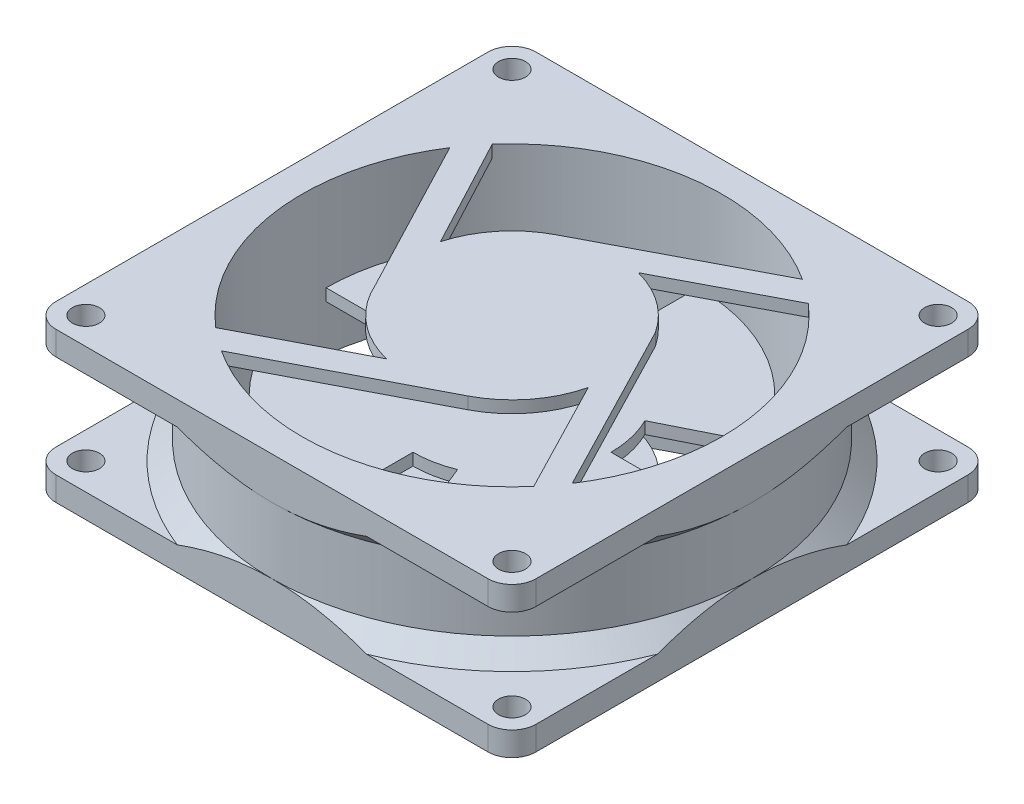
from build123d import *

# Parameters (mm, degrees)
SKETCH_1_W           = 80
SKETCH_1_H           = 80
EXTRUDE_1_DEPTH      = 4
SKETCH_3_R           = 40
EXTRUDE_2_DEPTH      = 17
SKETCH_4_W           = 80
SKETCH_4_H           = 80
EXTRUDE_3_DEPTH      = 4
SKETCH_5_R           = 35
CUT_EXTRUDE_2_DEPTH  = 38
SKETCH_6_R           = 2.25
CUT_EXTRUDE_3_DEPTH  = 38
FILLET_1_R           = 4
CHAMFER_3_SIZE       = 3
EXTRUDE_4_DEPTH      = 1
EXTRUDE_4_DEPTH_BACK = 1
EXTRUDE_5_DEPTH      = 2
EXTRUDE_START        = -2
EXTRUDE_6_DEPTH      = 2


with BuildPart() as part:
    # Эскиз1 → Бобышка-Вытянуть1 (new body)
    with BuildSketch(Plane(origin=(0, 0, 0), x_dir=(1, 0, 0), z_dir=(0, 1, 0))):
        with Locations((-12.139359553, 4.23945659)):
            Rectangle(SKETCH_1_W, SKETCH_1_H)
    extrude(amount=EXTRUDE_1_DEPTH)

    # Эскиз3 → Бобышка-Вытянуть2 (add)
    with BuildSketch(Plane(origin=(0, 4, 0), x_dir=(1, 0, 0), z_dir=(0, 1, 0))):
        with Locations(Location((-12.139359553, 4.23945659, 0), (0, 0, 270))):
            Circle(SKETCH_3_R)
    extrude(amount=EXTRUDE_2_DEPTH)

    # Эскиз4 → Бобышка-Вытянуть3 (add)
    with BuildSketch(Plane(origin=(0, 21, 0), x_dir=(1, 0, 0), z_dir=(0, 1, 0))):
        with Locations((-12.139359553, 4.23945659)):
            Rectangle(SKETCH_4_W, SKETCH_4_H)
    extrude(amount=EXTRUDE_3_DEPTH)

    # Эскиз5 → Вырез-Вытянуть2 (cut)
    with BuildSketch(Plane(origin=(0, 25, 0), x_dir=(1, 0, 0), z_dir=(0, 1, 0))):
        with Locations(Location((-12.139359553, 4.23945659, 0), (0, 0, 270))):
            Circle(SKETCH_5_R)
    extrude(amount=-CUT_EXTRUDE_2_DEPTH, mode=Mode.SUBTRACT)

    # Эскиз6 → Вырез-Вытянуть3 (cut)
    with BuildSketch(Plane(origin=(0, 25, 0), x_dir=(1, 0, 0), z_dir=(0, 1, 0))):
        with Locations(Location((-47.639359553, 39.73945659, 0), (0, 0, 270))):
            Circle(SKETCH_6_R)
        with Locations(Location((23.360640447, 39.73945659, 0), (0, 0, 270))):
            Circle(SKETCH_6_R)
        with Locations(Location((-47.639359553, -31.26054341, 0), (0, 0, 270))):
            Circle(SKETCH_6_R)
        with Locations(Location((23.360640447, -31.26054341, 0), (0, 0, 270))):
            Circle(SKETCH_6_R)
    extrude(amount=-CUT_EXTRUDE_3_DEPTH, mode=Mode.SUBTRACT)

    # Скругление1
    fillet_1_edges = [part.edges().sort_by_distance(p)[0] for p in [
        (-52.139359553, 23, -44.23945659),
        (-52.139359553, 23, 35.76054341),
        (27.860640447, 23, 35.76054341),
        (27.860640447, 23, -44.23945659),
        (-52.139359553, 2, -44.23945659),
        (27.860640447, 2, -44.23945659),
        (27.860640447, 2, 35.76054341),
        (-52.139359553, 2, 35.76054341),
    ]]
    fillet(fillet_1_edges, radius=FILLET_1_R)

    # Фаска3
    # the kernel refuses this chamfer: 3 mm, written as the material it adds along each edge
    with BuildSketch(Plane(origin=(-12.139359553, 4, -4.23945659), x_dir=(-1, 0, 0), z_dir=(0, 0, -1))) as chamfer_3_piece_1_section:
        Polygon((40, CHAMFER_3_SIZE), (40 + CHAMFER_3_SIZE, 0), (40, 0), align=None)
    chamfer_3_piece_1 = revolve(axis=Axis((-12.139359553, 4, -4.23945659), (0, 1, 0)), revolution_arc=90, mode=Mode.PRIVATE)
    chamfer_3_piece_1 = split(chamfer_3_piece_1, bisect_by=Plane(origin=(-52.139359553, 5.457700283, 25.075564413), z_dir=(1, 0, 0)), keep=Keep.TOP, mode=Mode.PRIVATE)
    chamfer_3_piece_1 = split(chamfer_3_piece_1, bisect_by=Plane(origin=(-41.454380555, 5.457700283, 35.76054341), z_dir=(0, 0, -1)), keep=Keep.TOP, mode=Mode.PRIVATE)
    add(chamfer_3_piece_1)
    with BuildSketch(Plane(origin=(-12.139359553, 4, -4.23945659), x_dir=(0, 0, -1), z_dir=(1, 0, 0))) as chamfer_3_piece_2_section:
        Polygon((40 + CHAMFER_3_SIZE, 0), (40, CHAMFER_3_SIZE), (40, 0), align=None)
    chamfer_3_piece_2 = revolve(axis=Axis((-12.139359553, 4, -4.23945659), (0, 1, 0)), revolution_arc=90, mode=Mode.PRIVATE)
    chamfer_3_piece_2 = split(chamfer_3_piece_2, bisect_by=Plane(origin=(-41.454380555, 5.457700283, -44.23945659), z_dir=(0, 0, 1)), keep=Keep.TOP, mode=Mode.PRIVATE)
    chamfer_3_piece_2 = split(chamfer_3_piece_2, bisect_by=Plane(origin=(-52.139359553, 5.457700283, -33.554477593), z_dir=(1, 0, 0)), keep=Keep.TOP, mode=Mode.PRIVATE)
    add(chamfer_3_piece_2)
    with BuildSketch(Plane(origin=(-12.139359553, 4, -4.23945659), x_dir=(1.0, 0, 8.787882221916732e-09), z_dir=(-8.787882221916732e-09, 0, 1.0))) as chamfer_3_piece_3_section:
        Polygon((40 + CHAMFER_3_SIZE, 0), (40, CHAMFER_3_SIZE), (40, 0), align=None)
    chamfer_3_piece_3 = revolve(axis=Axis((-12.139359553, 4, -4.23945659), (0, 1, 0)), revolution_arc=90.000000504, mode=Mode.PRIVATE)
    chamfer_3_piece_3 = split(chamfer_3_piece_3, bisect_by=Plane(origin=(17.175661571, 5.457700294, -44.23945659), z_dir=(0, 0, 1)), keep=Keep.TOP, mode=Mode.PRIVATE)
    chamfer_3_piece_3 = split(chamfer_3_piece_3, bisect_by=Plane(origin=(27.860640447, 5.457700294, -33.554477456), z_dir=(-1, 0, 0)), keep=Keep.TOP, mode=Mode.PRIVATE)
    add(chamfer_3_piece_3)
    with BuildSketch(Plane(origin=(-12.139359553, 4, -4.23945659), x_dir=(0, 0, 1), z_dir=(-1, 0, 0))) as chamfer_3_piece_4_section:
        Polygon((40, CHAMFER_3_SIZE), (40 + CHAMFER_3_SIZE, 0), (40, 0), align=None)
    chamfer_3_piece_4 = revolve(axis=Axis((-12.139359553, 4, -4.23945659), (0, 1, 0)), revolution_arc=89.999999496, mode=Mode.PRIVATE)
    chamfer_3_piece_4 = split(chamfer_3_piece_4, bisect_by=Plane(origin=(27.860640447, 5.457700283, 25.075564541), z_dir=(-1, 0, 0)), keep=Keep.TOP, mode=Mode.PRIVATE)
    chamfer_3_piece_4 = split(chamfer_3_piece_4, bisect_by=Plane(origin=(17.175661321, 5.457700283, 35.76054341), z_dir=(0, 0, -1)), keep=Keep.TOP, mode=Mode.PRIVATE)
    add(chamfer_3_piece_4)
    with BuildSketch(Plane(origin=(-12.139359553, 21, -4.23945659), x_dir=(0, 0, 1), z_dir=(-1, 0, 0))) as chamfer_3_piece_5_section:
        Polygon((40, -CHAMFER_3_SIZE), (40 + CHAMFER_3_SIZE, 0), (40, 0), align=None)
    chamfer_3_piece_5 = revolve(axis=Axis((-12.139359553, 21, -4.23945659), (0, 1, 0)), revolution_arc=90.000000093, mode=Mode.PRIVATE)
    chamfer_3_piece_5 = split(chamfer_3_piece_5, bisect_by=Plane(origin=(27.860640447, 19.542299715, 25.075564387), z_dir=(-1, 0, 0)), keep=Keep.TOP, mode=Mode.PRIVATE)
    chamfer_3_piece_5 = split(chamfer_3_piece_5, bisect_by=Plane(origin=(17.175661472, 19.542299715, 35.76054341), z_dir=(0, 0, -1)), keep=Keep.TOP, mode=Mode.PRIVATE)
    add(chamfer_3_piece_5)
    with BuildSketch(Plane(origin=(-12.139359553, 21, -4.23945659), x_dir=(1.0, 0, -1.6192726937092062e-09), z_dir=(1.6192726937092062e-09, 0, 1.0))) as chamfer_3_piece_6_section:
        Polygon((40, -CHAMFER_3_SIZE), (40 + CHAMFER_3_SIZE, 0), (40, 0), align=None)
    chamfer_3_piece_6 = revolve(axis=Axis((-12.139359553, 21, -4.23945659), (0, 1, 0)), revolution_arc=89.999999907, mode=Mode.PRIVATE)
    chamfer_3_piece_6 = split(chamfer_3_piece_6, bisect_by=Plane(origin=(17.175661426, 19.542299717, -44.23945659), z_dir=(0, 0, 1)), keep=Keep.TOP, mode=Mode.PRIVATE)
    chamfer_3_piece_6 = split(chamfer_3_piece_6, bisect_by=Plane(origin=(27.860640447, 19.542299717, -33.554477616), z_dir=(-1, 0, 0)), keep=Keep.TOP, mode=Mode.PRIVATE)
    add(chamfer_3_piece_6)
    with BuildSketch(Plane(origin=(-12.139359553, 21, -4.23945659), x_dir=(0, 0, -1), z_dir=(1, 0, 0))) as chamfer_3_piece_7_section:
        Polygon((40, -CHAMFER_3_SIZE), (40 + CHAMFER_3_SIZE, 0), (40, 0), align=None)
    chamfer_3_piece_7 = revolve(axis=Axis((-12.139359553, 21, -4.23945659), (0, 1, 0)), revolution_arc=90, mode=Mode.PRIVATE)
    chamfer_3_piece_7 = split(chamfer_3_piece_7, bisect_by=Plane(origin=(-41.454380555, 19.542299717, -44.23945659), z_dir=(0, 0, 1)), keep=Keep.TOP, mode=Mode.PRIVATE)
    chamfer_3_piece_7 = split(chamfer_3_piece_7, bisect_by=Plane(origin=(-52.139359553, 19.542299717, -33.554477593), z_dir=(1, 0, 0)), keep=Keep.TOP, mode=Mode.PRIVATE)
    add(chamfer_3_piece_7)
    with BuildSketch(Plane(origin=(-12.139359553, 21, -4.23945659), x_dir=(-1, 0, 0), z_dir=(0, 0, -1))) as chamfer_3_piece_8_section:
        Polygon((40, -CHAMFER_3_SIZE), (40 + CHAMFER_3_SIZE, 0), (40, 0), align=None)
    chamfer_3_piece_8 = revolve(axis=Axis((-12.139359553, 21, -4.23945659), (0, 1, 0)), revolution_arc=90, mode=Mode.PRIVATE)
    chamfer_3_piece_8 = split(chamfer_3_piece_8, bisect_by=Plane(origin=(-52.139359553, 19.542299717, 25.075564413), z_dir=(1, 0, 0)), keep=Keep.TOP, mode=Mode.PRIVATE)
    chamfer_3_piece_8 = split(chamfer_3_piece_8, bisect_by=Plane(origin=(-41.454380555, 19.542299717, 35.76054341), z_dir=(0, 0, -1)), keep=Keep.TOP, mode=Mode.PRIVATE)
    add(chamfer_3_piece_8)

    # Эскиз8 → Бобышка-Вытянуть5 (add)
    with BuildSketch(Plane(origin=(0, 25, 0), x_dir=(1, 0, 0), z_dir=(0, 1, 0))):
        with BuildLine():
            Line((8.198715257, 34.345651042), (-20.134931912, 19.520610741))
            ThreePointArc((-20.134931912, 19.520610741), (-25.530989427, 15.107165587), (-28.739134966, 8.918164292))
            Line((-28.739134966, 8.918164292), (-39.14955843, 28.539032471))
            ThreePointArc((-39.14955843, 28.539032471), (-40.756497042, 26.624265575), (-42.22797062, 24.603535637))
            Line((-42.22797062, 24.603535637), (-27.862533393, -2.84747885))
            ThreePointArc((-27.862533393, -2.84747885), (-23.198349305, -8.994650679), (-16.32036828, -12.4926089))
            Line((-16.32036828, -12.4926089), (-36.329458207, -22.868832889))
            ThreePointArc((-36.329458207, -22.868832889), (-34.506306833, -24.391643646), (-32.587541045, -25.792061936))
            Line((-32.587541045, -25.792061936), (-4.199797418, -11.070873343))
            ThreePointArc((-4.199797418, -11.070873343), (1.432709083, -6.402056577), (4.623006763, 0.181633892))
            Line((4.623006763, 0.181633892), (15.011922437, -19.902376764))
            ThreePointArc((15.011922437, -19.902376764), (16.468234928, -18.157546991), (17.812605081, -16.325077102))
            Line((17.812605081, -16.325077102), (2.283855016, 13.69534))
            ThreePointArc((2.283855016, 13.69534), (-2.069571834, 18.240964539), (-7.76414681, 20.921793447))
            Line((-7.76414681, 20.921793447), (12.091807498, 31.311042705))
            ThreePointArc((12.091807498, 31.311042705), (10.196856374, 32.894537979), (8.198715257, 34.345651042))
        make_face()
    extrude(amount=-EXTRUDE_5_DEPTH)

    # Эскиз9 → Бобышка-Вытянуть6 (add)
    with BuildSketch(Plane.XZ.offset(EXTRUDE_START)):
        with BuildLine():
            Line((-31.236462552, 25.091425719), (-5.619662436, 11.807180567))
            ThreePointArc((-5.619662436, 11.807180567), (0.954624714, 7.098470494), (4.674729653, -0.081642411))
            Line((4.674729653, -0.081642411), (14.354483046, 18.631404879))
            ThreePointArc((14.354483046, 18.631404879), (15.794357566, 16.848631231), (17.114481483, 14.975453887))
            Line((17.114481483, 14.975453887), (3.356052101, -11.978528384))
            ThreePointArc((3.356052101, -11.978528384), (-1.1894065, -17.65957368), (-7.666994922, -20.972626318))
            Line((-7.666994922, -20.972626318), (10.827935256, -30.649745668))
            ThreePointArc((10.827935256, -30.649745668), (8.892287068, -32.215693657), (6.850211416, -33.640072135))
            Line((6.850211416, -33.640072135), (-19.51460942, -19.911300895))
            ThreePointArc((-19.51460942, -19.911300895), (-25.3301569, -15.464601573), (-28.78923236, -9.0125845))
            Line((-28.78923236, -9.0125845), (-38.483138566, -27.283008992))
            ThreePointArc((-38.483138566, -27.283008992), (-40.075571458, -25.324239358), (-41.522676276, -23.255783742))
            Line((-41.522676276, -23.255783742), (-28.271072163, 2.066799257))
            ThreePointArc((-28.271072163, 2.066799257), (-23.611159336, 8.737400667), (-16.419363442, 12.543945367))
            Line((-16.419363442, 12.543945367), (-35.060584427, 22.210826022))
            ThreePointArc((-35.060584427, 22.210826022), (-33.197836064, 23.716590467), (-31.236462552, 25.091425719))
        make_face()
    extrude(amount=EXTRUDE_6_DEPTH)


with BuildPart() as body_2:
    # Эскиз7 → Бобышка-Вытянуть4 (new, two sides: drawn at the far end of the back side and taken through both)
    with BuildSketch(Plane(origin=(0, 12.5, 0), x_dir=(1, 0, 0), z_dir=(0, 1, 0)).offset(-EXTRUDE_4_DEPTH_BACK)):
        with BuildLine():
            Line((-12.139359553, 35.203260234), (-12.139359553, 20.73945659))
            ThreePointArc((-12.139359553, 20.73945659), (-15.303501581, 20.433227158), (-18.350194711, 19.525905708))
            Line((-18.350194711, 19.525905708), (-23.794576541, 32.925917735))
            ThreePointArc((-23.794576541, 32.925917735), (-37.826389221, 21.529154185), (-43.103163196, 4.23945659))
            Line((-43.103163196, 4.23945659), (-28.639359553, 4.23945659))
            ThreePointArc((-28.639359553, 4.23945659), (-28.198812588, 0.452113431), (-26.90069674, -3.132986996))
            Line((-26.90069674, -3.132986996), (-39.840398716, -9.595627991))
            ThreePointArc((-39.840398716, -9.595627991), (-28.423865896, -22.096298368), (-12.139359553, -26.724347054))
            Line((-12.139359553, -26.724347054), (-12.139359553, -12.26054341))
            ThreePointArc((-12.139359553, -12.26054341), (-8.975217524, -11.954313978), (-5.928524394, -11.046992528))
            Line((-5.928524394, -11.046992528), (-0.484142564, -24.447004555))
            ThreePointArc((-0.484142564, -24.447004555), (13.547670115, -13.050241005), (18.824444091, 4.23945659))
            Line((18.824444091, 4.23945659), (4.360640447, 4.23945659))
            ThreePointArc((4.360640447, 4.23945659), (3.920093483, 8.026799749), (2.621977635, 11.611900176))
            Line((2.621977635, 11.611900176), (15.561679611, 18.074541171))
            ThreePointArc((15.561679611, 18.074541171), (4.145146791, 30.575211548), (-12.139359553, 35.203260234))
        make_face()
    extrude(amount=EXTRUDE_4_DEPTH + EXTRUDE_4_DEPTH_BACK)


solid = Compound([part.part, body_2.part])
